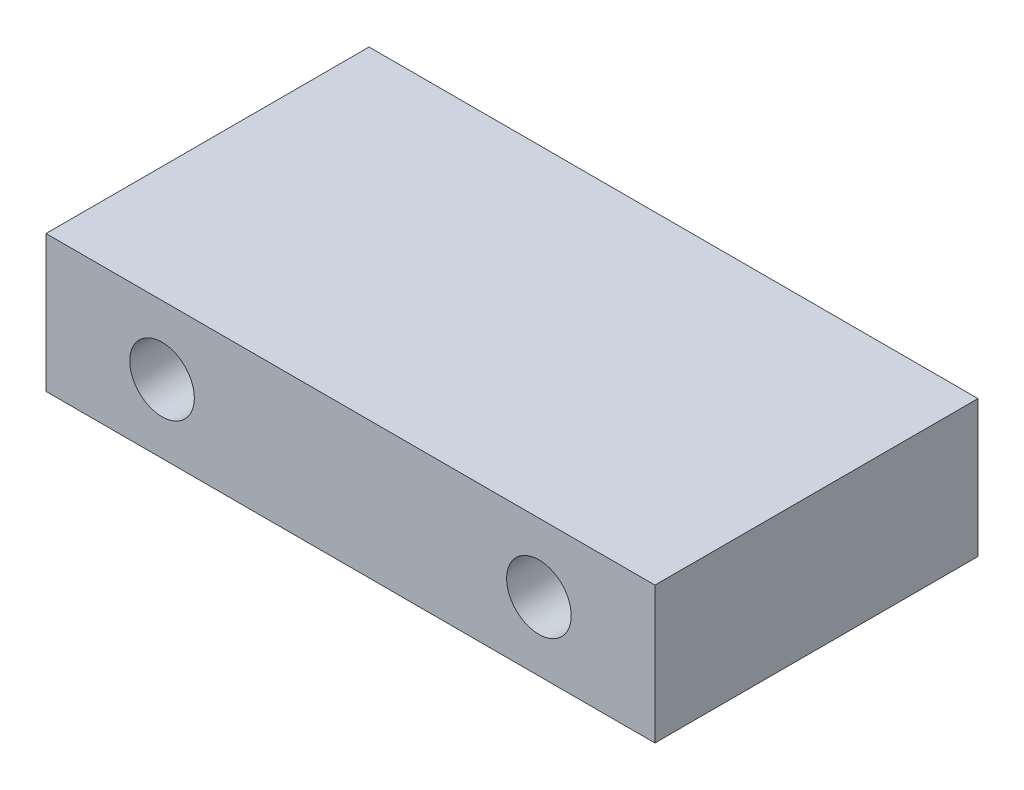
from build123d import *

# Parameters (mm, degrees)
SKETCH1_W           = 56.55
SKETCH1_H           = 12.7
BOSS_EXTRUDE1_DEPTH = 30
SKETCH2_R           = 3
CUT_EXTRUDE1_DEPTH  = 12


with BuildPart() as part:
    # Sketch1 → Boss-Extrude1 (new body)
    with BuildSketch(Plane.XY):
        Rectangle(SKETCH1_W, SKETCH1_H)
    extrude(amount=BOSS_EXTRUDE1_DEPTH)

    # Sketch2 → Cut-Extrude1 (cut)
    with BuildSketch(Plane.XY.offset(30)):
        with Locations((17.5, 0)):
            Circle(SKETCH2_R)
        with Locations((-17.5, 0)):
            Circle(SKETCH2_R)
    extrude(amount=-CUT_EXTRUDE1_DEPTH, mode=Mode.SUBTRACT)


solid = part.part
